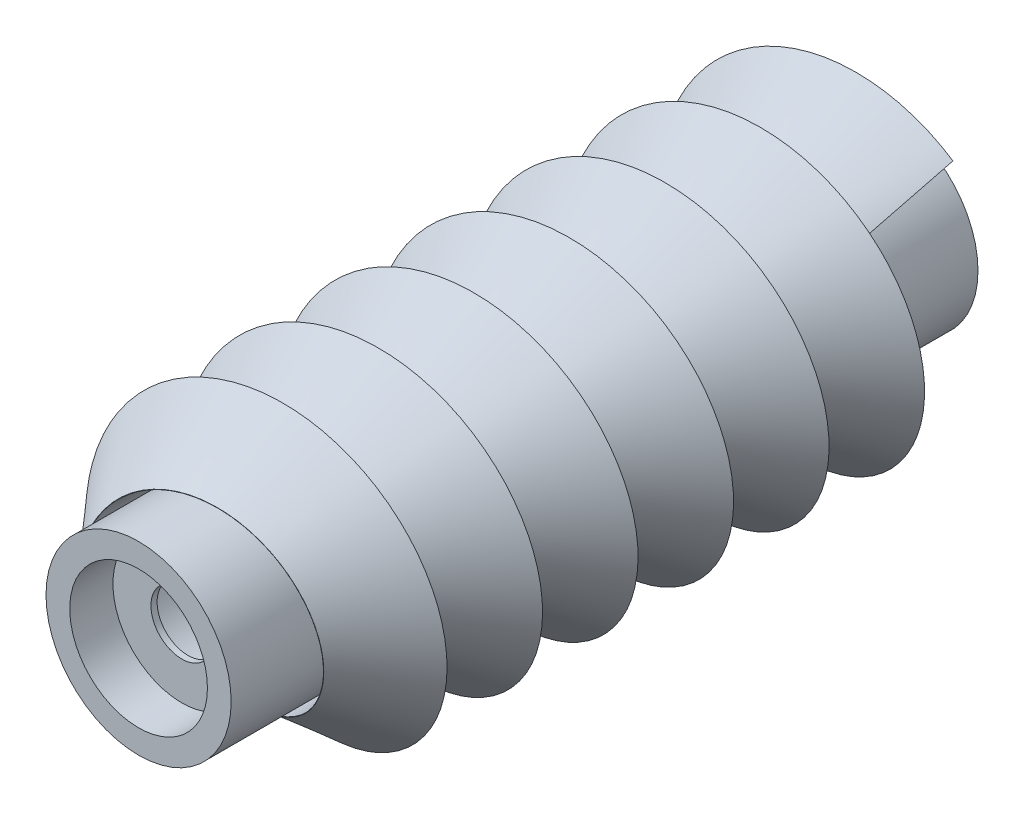
from build123d import *

# Parameters (mm, degrees)
SKETCH_1_R          = 15
SKETCH_1_R_2        = 11
EXTRUDE_1_DEPTH     = 63
SWEEP_1_PITCH       = 15.473846154
SKETCH_12_R         = 15
EXTRUDE_2_DEPTH     = 8
SKETCH_21_W         = 11.155
SKETCH_21_H         = 7
EXTRUDE_START       = 60
SKETCH_34_R         = 15
EXTRUDE_6_DEPTH     = 60
SKETCH_35_W         = 14
SKETCH_35_H         = 50
CUT_EXTRUDE_2_DEPTH = 20
MOVE_FACE_1_BY      = 10
SKETCH_44_W         = 5
SKETCH_44_H         = 20


with BuildPart() as part:
    # Эскиз1 → Бобышка-Вытянуть1 (new body)
    with BuildSketch(Plane.XY):
        Circle(SKETCH_1_R)
        Circle(SKETCH_1_R_2, mode=Mode.SUBTRACT)
    extrude(amount=EXTRUDE_1_DEPTH)

    # Эскиз12 → Бобышка-Вытянуть2 (add)
    with BuildSketch(Plane.XY.offset(63)):
        Circle(SKETCH_12_R)
    extrude(amount=EXTRUDE_2_DEPTH)

    # Эскиз21 → Отверстие1 (revolve, cut)
    with BuildSketch(Plane(origin=(0, 0, 71), x_dir=(0, -1, 0), z_dir=(1, 0, 0))):
        with Locations((5.5775, 3.5)):
            Rectangle(SKETCH_21_W, SKETCH_21_H)
    revolve(axis=Axis((0, 0, -39), (0, 0, 1)), mode=Mode.SUBTRACT)

    # Эскиз34 → Бобышка-Вытянуть6 (add)
    with BuildSketch(Plane(origin=(0, 0, 0), x_dir=(-1, 0, 0), z_dir=(0, 0, -1)).offset(EXTRUDE_START)):
        Circle(SKETCH_34_R)
    extrude(amount=-EXTRUDE_6_DEPTH)

    # Эскиз35 → Отверстие2 (revolve, cut)
    with BuildSketch(Plane(origin=(0, 0, -60), x_dir=(0, 1, 0), z_dir=(1, 0, 0))):
        with Locations((7, 25)):
            Rectangle(SKETCH_35_W, SKETCH_35_H)
    revolve(axis=Axis((0, 0, 50), (0, 0, -1)), mode=Mode.SUBTRACT)

    # Эскиз43 → Вырез-Вытянуть2 (cut)
    with BuildSketch(Plane(origin=(0, 0, -10), x_dir=(-1, 0, 0), z_dir=(0, 0, -1))):
        with BuildLine():
            Line((0.75, 2.279802623), (0.75, -2.279802623))
            ThreePointArc((0.75, -2.279802623), (-2.4, 0), (0.75, 2.279802623))
        make_face()
    extrude(amount=-CUT_EXTRUDE_2_DEPTH, mode=Mode.SUBTRACT)

    # Move Face 1: a face moved inward by 10.0
    extrude(part.faces().sort_by_distance((7.5, -12, -60))[0], amount=MOVE_FACE_1_BY, dir=(0, 0, 1), mode=Mode.SUBTRACT)

    # Эскиз44 → Отверстие3 (revolve, cut)
    with BuildSketch(Plane(origin=(0, 0, 64), x_dir=(0, -1, 0), z_dir=(1, 0, 0))):
        with Locations((2.5, 10)):
            Rectangle(SKETCH_44_W, SKETCH_44_H)
    revolve(axis=Axis((0, 0, -46), (0, 0, 1)), mode=Mode.SUBTRACT)


with BuildPart() as body_2:
    # По траектории1: the profile of Эскиз7 screwed along a right-hand helix of 6.5 turns, 18 arcs to a turn; built about Z, then put on its axis
    sweep_1_z = Axis((0, 0, 0), (0, 0, 1))
    sweep_1_corners = [(15, 0, 0), (15.738869287, -2.648152091, 16.129309555), (15.783333296, -2.648231163, 16.129791165), (25.270916097, -0.934380103, 5.691102854)]
    with BuildLine(mode=Mode.PRIVATE) as sweep_1_profile:
        Line(sweep_1_corners[0], sweep_1_corners[1])
        Line(sweep_1_corners[1], sweep_1_corners[2])
        Line(sweep_1_corners[2], sweep_1_corners[3])
        Line(sweep_1_corners[3], sweep_1_corners[0])
    sweep_1_cap = Face(sweep_1_profile.wire())
    sweep_1_turn_angles = [0, 10, 20, 30, 40, 50, 60, 70, 80, 90, 100, 110, 120, 130, 140, 150, 160, 170, 180, 190, 200, 210, 220, 230, 240, 250, 260, 270, 280, 290, 300, 310, 320, 330, 340, 350, 360]
    sweep_1_turn_weights = [1, 0.984807753012208, 1, 0.984807753012208, 1, 0.984807753012208, 1, 0.984807753012208, 1, 0.984807753012208, 1, 0.984807753012208, 1, 0.984807753012208, 1, 0.984807753012208, 1, 0.984807753012208, 1, 0.984807753012208, 1, 0.984807753012208, 1, 0.984807753012208, 1, 0.984807753012208, 1, 0.984807753012208, 1, 0.984807753012208, 1, 0.984807753012208, 1, 0.984807753012208, 1, 0.984807753012208, 1]
    sweep_1_turn_rails = [Edge.make_bspline([Vector(p[0], p[1], 0).rotate(sweep_1_z, sweep_1_turn_angles[k]) / sweep_1_turn_weights[k] + Vector(0, 0, p[2] + SWEEP_1_PITCH * sweep_1_turn_angles[k] / 360) for k in range(37)], [0, 0, 0, 1, 1, 2, 2, 3, 3, 4, 4, 5, 5, 6, 6, 7, 7, 8, 8, 9, 9, 10, 10, 11, 11, 12, 12, 13, 13, 14, 14, 15, 15, 16, 16, 17, 17, 18, 18, 18], 2, sweep_1_turn_weights) for p in sweep_1_corners]
    sweep_1_turn_sides = [Face.make_surface_from_curves(sweep_1_turn_rails[p[0]], sweep_1_turn_rails[p[1]]) for p in [(0, 1), (1, 2), (2, 3), (3, 0)]]
    sweep_1_last_angles = [2160, 2170, 2180, 2190, 2200, 2210, 2220, 2230, 2240, 2250, 2260, 2270, 2280, 2290, 2300, 2310, 2320, 2330, 2340]
    sweep_1_last_weights = [1, 0.984807753012208, 1, 0.984807753012208, 1, 0.984807753012208, 1, 0.984807753012208, 1, 0.984807753012208, 1, 0.984807753012208, 1, 0.984807753012208, 1, 0.984807753012208, 1, 0.984807753012208, 1]
    sweep_1_last_rails = [Edge.make_bspline([Vector(p[0], p[1], 0).rotate(sweep_1_z, sweep_1_last_angles[k]) / sweep_1_last_weights[k] + Vector(0, 0, p[2] + SWEEP_1_PITCH * sweep_1_last_angles[k] / 360) for k in range(19)], [0, 0, 0, 1, 1, 2, 2, 3, 3, 4, 4, 5, 5, 6, 6, 7, 7, 8, 8, 9, 9, 9], 2, sweep_1_last_weights) for p in sweep_1_corners]
    sweep_1_last_sides = [Face.make_surface_from_curves(sweep_1_last_rails[p[0]], sweep_1_last_rails[p[1]]) for p in [(0, 1), (1, 2), (2, 3), (3, 0)]]
    sweep_1 = Plane(origin=(0, 0, 0), x_dir=(0.6293203910498425, 0.7771459614569669, 0), z_dir=(0, 0, 1)) * Solid(Shell([*[p.moved(Location((0, 0, SWEEP_1_PITCH * i))) for i in range(6) for p in sweep_1_turn_sides], *sweep_1_last_sides, sweep_1_cap, sweep_1_cap.rotate(sweep_1_z, 2340).moved(Location((0, 0, SWEEP_1_PITCH * 2340 / 360)))]))
    add(sweep_1)


with BuildPart() as body_2_1:
    # Move Body 1: moved
    add(body_2.part.moved(Location((0, 0, -50))))


solid = Compound([part.part, body_2_1.part])
